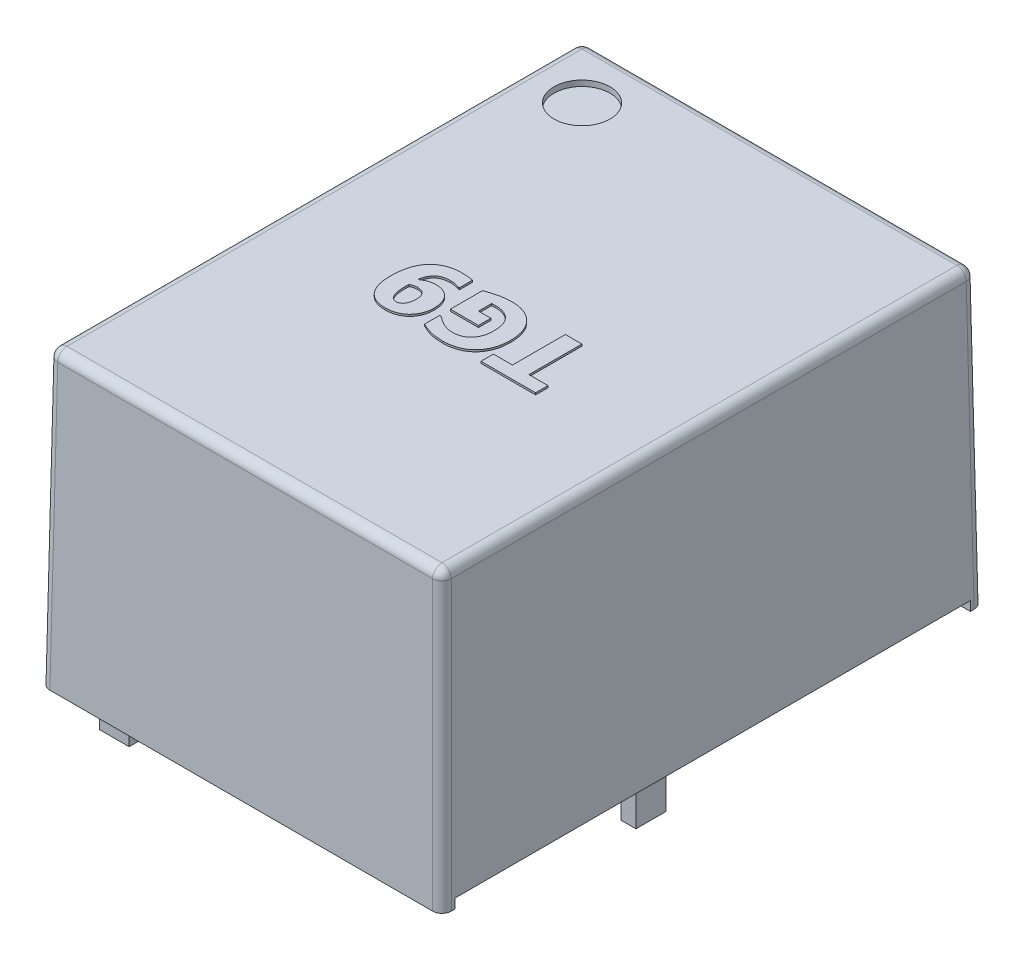
from build123d import *

# Parameters (mm, degrees)
SKETCH1_W           = 21.5
SKETCH1_H           = 29
BOSS_EXTRUDE1_DEPTH = 15.7
BOSS_EXTRUDE1_TAPER = 0.8
SKETCH2_W           = 21.5
SKETCH2_H           = 27.6
CUT_EXTRUDE1_DEPTH  = 0.5
SKETCH3_W           = 1.6
SKETCH3_H           = 0.8
SKETCH3_W_2         = 0.8
SKETCH3_H_2         = 1.6
SKETCH3_W_3         = 0.5
SKETCH3_H_3         = 0.5
BOSS_EXTRUDE2_DEPTH = 3
CHAMFER1_SIZE       = 0.3
FILLET1_R           = 0.5
SKETCH4_R           = 1.5
CUT_EXTRUDE2_DEPTH  = 0.3
WRAP1_DEPTH         = 0.1


# Read off the part's stored shape, not the designer's step: Wrap1
with BuildPart() as part:
    # Sketch1 → Boss-Extrude1 (new body)
    with BuildSketch(Plane(origin=(0, 0, 0), x_dir=(1, 0, 0), z_dir=(0, 1, 0))):
        Rectangle(SKETCH1_W, SKETCH1_H)
    extrude(amount=BOSS_EXTRUDE1_DEPTH, taper=BOSS_EXTRUDE1_TAPER)

    # Sketch2 → Cut-Extrude1 (cut)
    with BuildSketch(Plane.XZ):
        Rectangle(SKETCH2_W, SKETCH2_H)
    extrude(amount=-CUT_EXTRUDE1_DEPTH, mode=Mode.SUBTRACT)

    # Sketch3 → Boss-Extrude2 (add)
    with BuildSketch(Plane.XZ.offset(-0.5)):
        with Locations((-8.503018229, 12.4)):
            Rectangle(SKETCH3_W, SKETCH3_H)
        with Locations((-8.503018229, 4.78)):
            Rectangle(SKETCH3_W, SKETCH3_H)
        with Locations((9.276981771, 2.24)):
            Rectangle(SKETCH3_W_2, SKETCH3_H_2)
        with Locations((-4.693018229, -10.46)):
            Rectangle(SKETCH3_W_3, SKETCH3_H_3)
        with Locations((5.466981771, -10.46)):
            Rectangle(SKETCH3_W_3, SKETCH3_H_3)
    extrude(amount=BOSS_EXTRUDE2_DEPTH)

    # Chamfer1
    chamfer1_edges = [part.edges().sort_by_distance(p)[0] for p in [
        (-7.703018229, -2.5, 12.4),
        (-8.503018229, -2.5, 12.8),
        (-9.303018229, -2.5, 12.4),
        (-8.503018229, -2.5, 12),
        (-7.703018229, -2.5, 4.78),
        (-8.503018229, -2.5, 5.18),
        (-9.303018229, -2.5, 4.78),
        (-8.503018229, -2.5, 4.38),
        (9.676981771, -2.5, 2.24),
        (9.276981771, -2.5, 3.04),
        (8.876981771, -2.5, 2.24),
        (9.276981771, -2.5, 1.44),
    ]]
    chamfer(chamfer1_edges, length=CHAMFER1_SIZE)

    # Fillet1
    fillet1_edges = [part.edges().sort_by_distance(p)[0] for p in [
        (-10.530772399, 15.7, 0),
        (0, 15.7, 14.280772399),
        (10.530772399, 15.7, 0),
        (10.6403862, 7.85, 14.3903862),
        (-10.6403862, 7.85, 14.3903862),
        (-10.6403862, 7.85, -14.3903862),
        (10.6403862, 7.85, -14.3903862),
        (0, 15.7, -14.280772399),
    ]]
    fillet(fillet1_edges, radius=FILLET1_R)

    # Sketch4 → Cut-Extrude2 (cut)
    with BuildSketch(Plane(origin=(0, 15.7, 0), x_dir=(1, 0, 0), z_dir=(0, 1, 0))):
        with Locations(Location((-7.537656689, 11.287656689, 0), (0, 0, 270))):
            Circle(SKETCH4_R)
    extrude(amount=-CUT_EXTRUDE2_DEPTH, mode=Mode.SUBTRACT)

    # Wrap1 outline → Wrap1 (add)
    # profile 1 of 3: a face of its own
    with BuildSketch(Plane(origin=(0, 15.7, 0), x_dir=(1, 0, 0), z_dir=(0, 1, 0))):
        with BuildLine():
            add(Edge.make_bspline(
                [(-0.102452532, 0.088607595), (-0.036860506, 0.087134928), (0.091250349, 0.084258594), (0.278342255, 0.062131624), (0.45488028, 0.023999735), (0.621323867, -0.028803569), (0.778227827, -0.095678114), (0.924092949, -0.179495584), (1.060099395, -0.27756029), (1.18482818, -0.390581629), (1.29693773, -0.517333131), (1.395580395, -0.656707859), (1.478052408, -0.80931858), (1.545296988, -0.974701885), (1.59775191, -1.152341059), (1.634889705, -1.342602728), (1.657126754, -1.545256886), (1.659944939, -1.68464052), (1.661392405, -1.756230222)],
                knots=[0, 0, 0, 0, 0.067995856, 0.132805888, 0.194981824, 0.254982141, 0.313600982, 0.371466057, 0.429036606, 0.487133173, 0.545604876, 0.604148973, 0.663778491, 0.725044229, 0.788932318, 0.855511013, 0.925788105, 1, 1, 1, 1], degree=3))
            add(Edge.make_bspline(
                [(-1.39556962, -0.183445411), (-1.355308942, -0.167661974), (-1.269934301, -0.134192459), (-1.132080278, -0.08806817), (-0.977274877, -0.043835249), (-0.809523159, 0.001255076), (-0.633395524, 0.039466375), (-0.455318386, 0.068217637), (-0.278390267, 0.085305679), (-0.160867633, 0.087511288), (-0.102452532, 0.088607595)],
                knots=[0, 0, 0, 0, 0.097620883, 0.207009625, 0.328017714, 0.461075283, 0.599121247, 0.734700463, 0.868131791, 1, 1, 1, 1], degree=3))
            Line((-1.39556962, -0.183445411), (-1.39556962, -1.905063291))
            Line((-1.39556962, -1.905063291), (0.110759494, -1.905063291))
            Line((0.110759494, -1.905063291), (0.110759494, -1.240506329))
            Line((0.110759494, -1.240506329), (-0.553797468, -1.240506329))
            Line((-0.553797468, -1.240506329), (-0.553797468, -0.541337025))
            add(Edge.make_bspline(
                [(-0.339200949, -0.53164557), (-0.355817304, -0.531786898), (-0.391599283, -0.532091236), (-0.446504674, -0.534469309), (-0.501490393, -0.53653782), (-0.537192728, -0.53981353), (-0.553797468, -0.541337025)],
                knots=[0, 0, 0, 0, 0.231975873, 0.499541322, 0.767242498, 1, 1, 1, 1], degree=3))
            add(Edge.make_bspline(
                [(0.775316456, -1.752768987), (0.774387409, -1.702204278), (0.772593465, -1.604566196), (0.758825871, -1.463111342), (0.735289386, -1.33189757), (0.703453693, -1.210381664), (0.660954073, -1.099551855), (0.609632997, -0.998751385), (0.548542476, -0.908244753), (0.47804043, -0.828018611), (0.399493262, -0.758212499), (0.314220184, -0.697142816), (0.221779163, -0.646168447), (0.122927514, -0.603491052), (0.017053213, -0.570981857), (-0.095684181, -0.548535238), (-0.215160986, -0.534383148), (-0.297163757, -0.532573336), (-0.339200949, -0.53164557)],
                knots=[0, 0, 0, 0, 0.080365497, 0.155182003, 0.225615876, 0.292076694, 0.354538963, 0.413920832, 0.471499204, 0.527636676, 0.583225089, 0.638184361, 0.69400823, 0.750693002, 0.809047669, 0.869686027, 0.933196971, 1, 1, 1, 1], degree=3))
            add(Edge.make_bspline(
                [(0.479727057, -2.631230222), (0.501745853, -2.606062151), (0.54666412, -2.554719375), (0.604590962, -2.467839743), (0.654421486, -2.370913904), (0.698210648, -2.265380859), (0.732752063, -2.149895896), (0.757290301, -2.025430519), (0.772949872, -1.892078448), (0.774512087, -1.800118297), (0.775316456, -1.752768987)],
                knots=[0, 0, 0, 0, 0.105634929, 0.215494888, 0.329039652, 0.449740186, 0.576206227, 0.709396218, 0.850371186, 1, 1, 1, 1], degree=3))
            add(Edge.make_bspline(
                [(-0.251285601, -2.924050633), (-0.21502491, -2.923017438), (-0.143878087, -2.920990214), (-0.039657563, -2.908104067), (0.059152178, -2.884806898), (0.153516342, -2.853763741), (0.24314637, -2.813047402), (0.327205877, -2.76150693), (0.407945236, -2.702531906), (0.455606386, -2.655189553), (0.479727057, -2.631230222)],
                knots=[0, 0, 0, 0, 0.134281414, 0.263472523, 0.388037266, 0.509627174, 0.630832188, 0.751578548, 0.874277223, 1, 1, 1, 1], degree=3))
            add(Edge.make_bspline(
                [(-0.910304589, -2.753757911), (-0.888074262, -2.765385376), (-0.842475688, -2.789235489), (-0.769653632, -2.819579347), (-0.692536442, -2.849095905), (-0.610674542, -2.875447745), (-0.524624933, -2.896581779), (-0.435713687, -2.91298656), (-0.344220462, -2.921698674), (-0.282452604, -2.923261871), (-0.251285601, -2.924050633)],
                knots=[0, 0, 0, 0, 0.109431259, 0.224464062, 0.343971482, 0.469762124, 0.599446386, 0.730402799, 0.863965871, 1, 1, 1, 1], degree=3))
            add(Edge.make_bspline(
                [(-1.316653481, -2.481012658), (-1.305094068, -2.48928944), (-1.279575129, -2.507561534), (-1.238591396, -2.537998476), (-1.19021811, -2.572557154), (-1.119231872, -2.625697071), (-1.026091066, -2.688575938), (-0.947976009, -2.732550793), (-0.910304589, -2.753757911)],
                knots=[0, 0, 0, 0, 0.087070275, 0.192219205, 0.312640982, 0.451142808, 0.735310565, 1, 1, 1, 1], degree=3))
            Line((-1.316653481, -2.481012658), (-1.39556962, -2.481012658))
            Line((-1.39556962, -2.481012658), (-1.39556962, -3.284711234))
            add(Edge.make_bspline(
                [(-0.13568038, -3.588607595), (-0.170755101, -3.588267273), (-0.239306249, -3.587602137), (-0.339767479, -3.584591952), (-0.435070672, -3.57736009), (-0.525546281, -3.568341347), (-0.610848019, -3.557739818), (-0.691181561, -3.543640357), (-0.766373613, -3.527461438), (-0.860236757, -3.50087538), (-0.97523663, -3.46296598), (-1.113618213, -3.411115059), (-1.254321707, -3.35136598), (-1.347950492, -3.307182652), (-1.39556962, -3.284711234)],
                knots=[0, 0, 0, 0, 0.080315019, 0.156970221, 0.23007267, 0.299099769, 0.36515738, 0.426828784, 0.485797588, 0.541172827, 0.650108809, 0.762962826, 0.879444086, 1, 1, 1, 1], degree=3))
            add(Edge.make_bspline(
                [(1.661392405, -1.756230222), (1.659928872, -1.823898191), (1.657073504, -1.955919082), (1.634840265, -2.148967472), (1.596761653, -2.331477663), (1.544116539, -2.503947094), (1.477171654, -2.666565156), (1.393150725, -2.818025248), (1.29558712, -2.960110881), (1.182557383, -3.090181821), (1.056691172, -3.207050885), (0.919312964, -3.309787279), (0.770639505, -3.396833264), (0.610224537, -3.46651757), (0.439354626, -3.521583891), (0.257573948, -3.560589976), (0.064567695, -3.584710917), (-0.067767079, -3.587286053), (-0.13568038, -3.588607595)],
                knots=[0, 0, 0, 0, 0.069974437, 0.136520831, 0.200644225, 0.262546832, 0.322779049, 0.382166604, 0.441349051, 0.500731331, 0.560004171, 0.618665125, 0.67781099, 0.737760284, 0.799194642, 0.863184221, 0.929787078, 1, 1, 1, 1], degree=3))
        make_face()
    # profile 2 of 3: a face of its own
    with BuildSketch(Plane(origin=(0, 15.7, 0), x_dir=(1, 0, 0), z_dir=(0, 1, 0))):
        with BuildLine():
            add(Edge.make_bspline(
                [(-4.11471519, -0.47695807), (-4.095611162, -0.454554266), (-4.057551022, -0.409920124), (-3.995643247, -0.347632707), (-3.930272463, -0.289387865), (-3.86186126, -0.234525021), (-3.789761765, -0.184212707), (-3.714696825, -0.137252499), (-3.635490735, -0.095457154), (-3.553191416, -0.056129019), (-3.466252424, -0.022486506), (-3.37503271, 0.007482237), (-3.279220122, 0.033196034), (-3.178278043, 0.05287894), (-3.072956948, 0.068805953), (-2.963033911, 0.08055079), (-2.848228923, 0.087635625), (-2.770151429, 0.088278712), (-2.730221519, 0.088607595)],
                knots=[0, 0, 0, 0, 0.057007251, 0.113573117, 0.169910791, 0.226513718, 0.283298068, 0.340096484, 0.397877983, 0.456653306, 0.51665442, 0.57827144, 0.642553514, 0.708637207, 0.777339156, 0.848801128, 0.922674805, 1, 1, 1, 1], degree=3))
            add(Edge.make_bspline(
                [(-4.541139241, -1.947290348), (-4.540029742, -1.873639118), (-4.537851937, -1.729071184), (-4.518208338, -1.517192387), (-4.48561181, -1.314862239), (-4.441150986, -1.12232667), (-4.383292521, -0.940461336), (-4.308295477, -0.772364503), (-4.221420403, -0.616122014), (-4.150030323, -0.523015737), (-4.11471519, -0.47695807)],
                knots=[0, 0, 0, 0, 0.1415468, 0.277838245, 0.408582162, 0.535212971, 0.657384153, 0.774745731, 0.888571571, 1, 1, 1, 1], degree=3))
            add(Edge.make_bspline(
                [(-4.141712816, -3.236946203), (-4.173423774, -3.201750477), (-4.237999931, -3.130077943), (-4.317375156, -3.00514766), (-4.386307734, -2.867169729), (-4.433071204, -2.741935802), (-4.463794526, -2.634473455), (-4.484429197, -2.548533628), (-4.502821206, -2.458604679), (-4.516123651, -2.364212912), (-4.527250802, -2.265878395), (-4.535608296, -2.163390319), (-4.540521744, -2.056714709), (-4.540930867, -1.984215392), (-4.541139241, -1.947290348)],
                knots=[0, 0, 0, 0, 0.102569142, 0.208871681, 0.319631709, 0.436634701, 0.498076444, 0.561908187, 0.628240155, 0.697017879, 0.768515358, 0.842808283, 0.919939782, 1, 1, 1, 1], degree=3))
            add(Edge.make_bspline(
                [(-3.19818038, -3.588607595), (-3.247371906, -3.587532361), (-3.343253602, -3.585436569), (-3.482746381, -3.569527645), (-3.61393905, -3.542565333), (-3.736761191, -3.504716679), (-3.851467476, -3.455468024), (-3.957091768, -3.393957806), (-4.055222506, -3.322064921), (-4.112824984, -3.265375922), (-4.141712816, -3.236946203)],
                knots=[0, 0, 0, 0, 0.142383604, 0.2775271, 0.405784193, 0.529596248, 0.648973433, 0.766297681, 0.88279752, 1, 1, 1, 1], degree=3))
            add(Edge.make_bspline(
                [(-2.238034019, -3.221716772), (-2.266945705, -3.249449815), (-2.325336493, -3.305460185), (-2.425413433, -3.376713334), (-2.533781132, -3.440396158), (-2.651791053, -3.493331375), (-2.777671874, -3.53656144), (-2.911566976, -3.566837172), (-3.052535732, -3.585026464), (-3.148975779, -3.587397745), (-3.19818038, -3.588607595)],
                knots=[0, 0, 0, 0, 0.113748174, 0.229728753, 0.348190481, 0.470603204, 0.596718869, 0.725921667, 0.86016271, 1, 1, 1, 1], degree=3))
            add(Edge.make_bspline(
                [(-1.882911392, -2.302412975), (-1.883879631, -2.347698302), (-1.885783985, -2.436766494), (-1.903697717, -2.567723249), (-1.932481377, -2.693467159), (-1.973602853, -2.813410906), (-2.024838519, -2.926850636), (-2.085167457, -3.033623059), (-2.155796137, -3.132702532), (-2.210614075, -3.192037439), (-2.238034019, -3.221716772)],
                knots=[0, 0, 0, 0, 0.134344247, 0.264231259, 0.391484363, 0.516665756, 0.639887205, 0.760426384, 0.880165226, 1, 1, 1, 1], degree=3))
            add(Edge.make_bspline(
                [(-2.267800633, -1.35195807), (-2.239231199, -1.376669092), (-2.181554656, -1.426556196), (-2.10640222, -1.514327094), (-2.040925776, -1.612721654), (-1.993653636, -1.701778428), (-1.961641244, -1.779069731), (-1.939621807, -1.841463661), (-1.923395535, -1.908741917), (-1.907258039, -1.97933789), (-1.89692698, -2.054418864), (-1.88835725, -2.13333779), (-1.883530947, -2.216514037), (-1.883121135, -2.273332936), (-1.882911392, -2.302412975)],
                knots=[0, 0, 0, 0, 0.106481276, 0.214966524, 0.324770655, 0.43952923, 0.498784341, 0.560767327, 0.625993436, 0.693938589, 0.765030887, 0.839672687, 0.917944126, 1, 1, 1, 1], degree=3))
            add(Edge.make_bspline(
                [(-2.904667722, -1.151898734), (-2.875330918, -1.152292061), (-2.817182607, -1.153071673), (-2.731195174, -1.163523152), (-2.646927646, -1.178495542), (-2.564706301, -1.19987869), (-2.485064951, -1.22760724), (-2.408382676, -1.26120613), (-2.336025134, -1.303300984), (-2.290631595, -1.335675238), (-2.267800633, -1.35195807)],
                knots=[0, 0, 0, 0, 0.12945193, 0.256585927, 0.381881924, 0.507165494, 0.631212662, 0.753896818, 0.876220879, 1, 1, 1, 1], degree=3))
            add(Edge.make_bspline(
                [(-3.640526108, -1.396954114), (-3.610438136, -1.37803817), (-3.552097008, -1.34135981), (-3.464896382, -1.291681768), (-3.380235293, -1.250817747), (-3.298314084, -1.213380277), (-3.212253569, -1.184715663), (-3.118091728, -1.166052218), (-3.014577849, -1.15414837), (-2.942315677, -1.152669311), (-2.904667722, -1.151898734)],
                knots=[0, 0, 0, 0, 0.135139297, 0.262037567, 0.381327552, 0.492510506, 0.604328678, 0.725300895, 0.856884182, 1, 1, 1, 1], degree=3))
            add(Edge.make_bspline(
                [(-3.335245253, -0.762856013), (-3.35446322, -0.780547311), (-3.393170326, -0.816179539), (-3.446508807, -0.876009823), (-3.492829068, -0.943623885), (-3.536178053, -1.016755683), (-3.572027307, -1.098623567), (-3.601828811, -1.189473146), (-3.625223255, -1.289815576), (-3.635305127, -1.360400916), (-3.640526108, -1.396954114)],
                knots=[0, 0, 0, 0, 0.108642429, 0.218817837, 0.332537108, 0.449109557, 0.572019786, 0.703465933, 0.846437398, 1, 1, 1, 1], degree=3))
            add(Edge.make_bspline(
                [(-2.733682753, -0.575949367), (-2.761849892, -0.576501346), (-2.817845642, -0.57759867), (-2.900992551, -0.585787166), (-2.982425624, -0.600996991), (-3.062102447, -0.619508387), (-3.138553575, -0.645018869), (-3.209779776, -0.677482476), (-3.275811636, -0.716408115), (-3.31548357, -0.747412082), (-3.335245253, -0.762856013)],
                knots=[0, 0, 0, 0, 0.131514242, 0.261447876, 0.389518856, 0.518087376, 0.643126905, 0.765107229, 0.882993439, 1, 1, 1, 1], degree=3))
            add(Edge.make_bspline(
                [(-2.216574367, -0.664556962), (-2.228520864, -0.659795908), (-2.254436429, -0.649467741), (-2.297633954, -0.636072349), (-2.347490765, -0.621578512), (-2.404676669, -0.605859155), (-2.471039746, -0.591564803), (-2.54840247, -0.582421027), (-2.637153924, -0.577143175), (-2.700215672, -0.576363267), (-2.733682753, -0.575949367)],
                knots=[0, 0, 0, 0, 0.073018872, 0.158400011, 0.256695939, 0.367966851, 0.495204297, 0.641834821, 0.809920537, 1, 1, 1, 1], degree=3))
            Line((-2.216574367, -0.664556962), (-2.148734177, -0.664556962))
            Line((-2.148734177, -0.664556962), (-2.148734177, 0.029074367))
            add(Edge.make_bspline(
                [(-2.730221519, 0.088607595), (-2.674114177, 0.0874597), (-2.559381418, 0.085112393), (-2.417520202, 0.071328788), (-2.309495773, 0.057543885), (-2.242217434, 0.04833079), (-2.190304623, 0.038772483), (-2.160946412, 0.031923402), (-2.148734177, 0.029074367)],
                knots=[0, 0, 0, 0, 0.287471653, 0.587844919, 0.729660372, 0.845538697, 0.935748207, 1, 1, 1, 1], degree=3))
        make_face()
        with BuildLine():
            add(Edge.make_bspline(
                [(-3.479924842, -2.866594146), (-3.469978068, -2.878766962), (-3.450634583, -2.902439429), (-3.418999494, -2.934099457), (-3.384487727, -2.958997572), (-3.337342191, -2.986151912), (-3.271979686, -3.008170307), (-3.217515465, -3.011147316), (-3.189873418, -3.012658228)],
                knots=[0, 0, 0, 0, 0.139699871, 0.271674251, 0.396372897, 0.516694178, 0.754709377, 1, 1, 1, 1], degree=3))
            add(Edge.make_bspline(
                [(-3.655063291, -2.083662975), (-3.654677018, -2.130525359), (-3.653937922, -2.220191846), (-3.644448675, -2.348129255), (-3.631530629, -2.46341773), (-3.611526228, -2.56596387), (-3.585710683, -2.656558163), (-3.556222938, -2.736667494), (-3.522260923, -2.806958277), (-3.493615016, -2.847309757), (-3.479924842, -2.866594146)],
                knots=[0, 0, 0, 0, 0.17241587, 0.329900527, 0.471882897, 0.599117453, 0.713894301, 0.818152727, 0.913093314, 1, 1, 1, 1], degree=3))
            add(Edge.make_bspline(
                [(-3.648140823, -1.857298259), (-3.648258472, -1.868148327), (-3.648536601, -1.893798434), (-3.651494566, -1.92858107), (-3.653091482, -1.964130084), (-3.654612726, -1.998271761), (-3.655206914, -2.038895977), (-3.655113631, -2.067972147), (-3.655063291, -2.083662975)],
                knots=[0, 0, 0, 0, 0.143660574, 0.339620838, 0.462010193, 0.614928198, 0.792197688, 1, 1, 1, 1], degree=3))
            add(Edge.make_bspline(
                [(-3.293018196, -1.772151899), (-3.324999358, -1.773428393), (-3.390801504, -1.776054816), (-3.485455897, -1.799285944), (-3.572580062, -1.824483345), (-3.624769377, -1.847148388), (-3.648140823, -1.857298259)],
                knots=[0, 0, 0, 0, 0.260565123, 0.536120109, 0.792265064, 1, 1, 1, 1], degree=3))
            add(Edge.make_bspline(
                [(-2.924050633, -1.891218354), (-2.936302713, -1.880803829), (-2.960507778, -1.860229016), (-3.0004054, -1.834006535), (-3.043682541, -1.814408541), (-3.104681798, -1.792705846), (-3.188324504, -1.775962825), (-3.257170164, -1.773456793), (-3.293018196, -1.772151899)],
                knots=[0, 0, 0, 0, 0.121500025, 0.240034024, 0.359424798, 0.479691544, 0.729074657, 1, 1, 1, 1], degree=3))
            add(Edge.make_bspline(
                [(-2.768987342, -2.360561709), (-2.769545135, -2.332626022), (-2.770612265, -2.279181527), (-2.77787758, -2.202939405), (-2.791003588, -2.134592821), (-2.808937932, -2.073521213), (-2.831921361, -2.019396908), (-2.858533954, -1.970903216), (-2.888470883, -1.927658176), (-2.912397684, -1.903152991), (-2.924050633, -1.891218354)],
                knots=[0, 0, 0, 0, 0.164959608, 0.315588556, 0.451605723, 0.575328712, 0.690728626, 0.798059821, 0.901650098, 1, 1, 1, 1], degree=3))
            add(Edge.make_bspline(
                [(-2.908128956, -2.866594146), (-2.898618522, -2.853628417), (-2.87834975, -2.825995674), (-2.852312255, -2.778216573), (-2.829948472, -2.721884079), (-2.808533057, -2.658969018), (-2.790576597, -2.589885457), (-2.778538037, -2.516415617), (-2.770596692, -2.439650634), (-2.769532434, -2.387349363), (-2.768987342, -2.360561709)],
                knots=[0, 0, 0, 0, 0.090381242, 0.192621775, 0.304943593, 0.430950077, 0.566315198, 0.705865611, 0.849350308, 1, 1, 1, 1], degree=3))
            add(Edge.make_bspline(
                [(-3.189873418, -3.012658228), (-3.164987671, -3.011006759), (-3.114958841, -3.007686742), (-3.054491925, -2.986283206), (-3.007921215, -2.961343105), (-2.974038877, -2.93473904), (-2.93966335, -2.903777124), (-2.918925408, -2.879324507), (-2.908128956, -2.866594146)],
                knots=[0, 0, 0, 0, 0.226764239, 0.455873387, 0.578407211, 0.70772174, 0.847836006, 1, 1, 1, 1], degree=3))
        make_face(mode=Mode.SUBTRACT)
    # profile 3 of 3: a face of its own
    with BuildSketch(Plane(origin=(0, 15.7, 0), x_dir=(1, 0, 0), z_dir=(0, 1, 0))):
        Polygon((4.762658228, -2.835443038), (3.743670886, -2.835443038), (3.743670886, 0), (2.857594937, 0), (2.857594937, -2.835443038), (1.838607595, -2.835443038), (1.838607595, -3.5), (4.762658228, -3.5), align=None)
    extrude(amount=WRAP1_DEPTH)


solid = part.part
